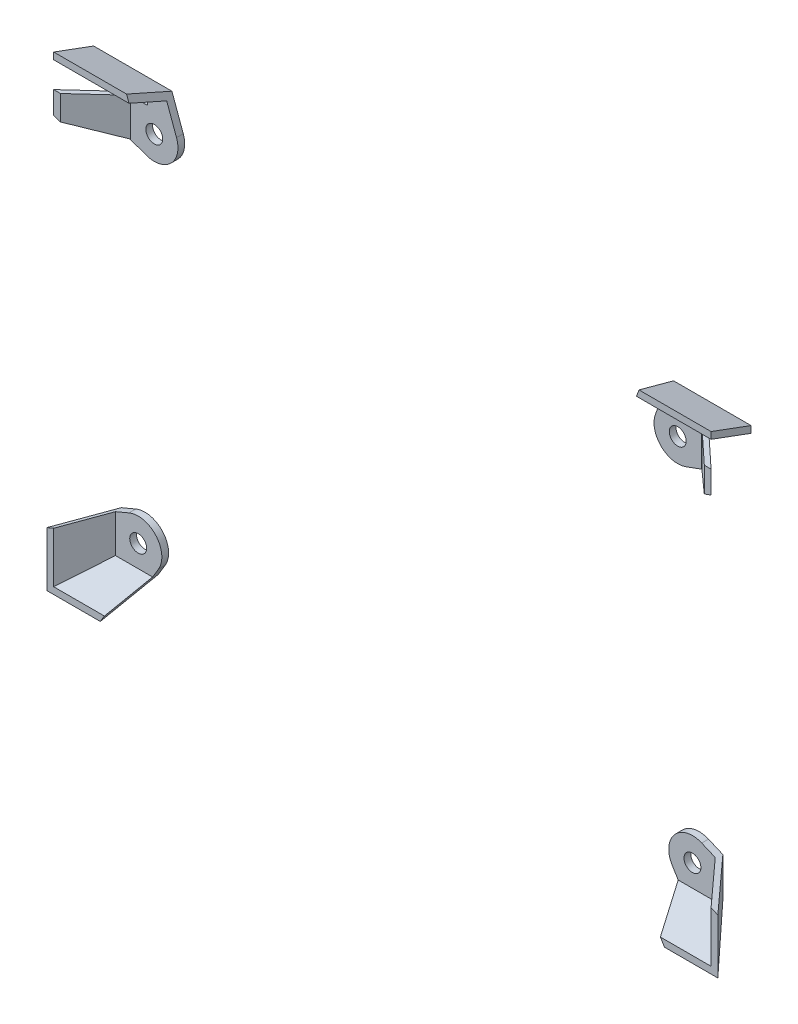
from build123d import *

# Parameters (mm, degrees)
SKETCH4_7_R              = 3.175
BOSS_EXTRUDE7_DEPTH      = 2.54
SKETCH4_9_R              = 3.175
BOSS_EXTRUDE8_DEPTH      = 2.54
BOSS_EXTRUDE9_OUTLINE_R  = 3.175
BOSS_EXTRUDE9_DEPTH      = 2.54
BOSS_EXTRUDE10_OUTLINE_R = 3.175
BOSS_EXTRUDE10_DEPTH     = 2.54


# Read off the part's stored shape, not the designer's step: Boss-Extrude9, Boss-Extrude10
with BuildPart() as part:
    # Sketch9 → Loft2 section 0
    with BuildSketch(Plane.XY):
        with BuildLine():
            Line((-113.266429258, -70.57186866), (-113.266429258, -85.367634727))
            Line((-113.266429258, -85.367634727), (-99.366399677, -85.367634727))
            Line((-99.366399677, -85.367634727), (-97.8285786, -82.827634727))
            Line((-97.8285786, -82.827634727), (-110.726429258, -82.827634727))
            Line((-110.726429258, -82.827634727), (-110.726429258, -69.503807701))
            Line((-110.726429258, -69.503807701), (-113.266429258, -70.57186866))
        make_face()
    # Sketch8 → Loft2 section 1
    with BuildSketch(Plane.XY.offset(15.022907724)):
        with BuildLine():
            Line((-104.580681896, -93.98), (-123.630681896, -93.98))
            Line((-123.630681896, -93.98), (-123.630681896, -74.93))
            Line((-123.630681896, -74.93), (-126.170681896, -75.998060958))
            Line((-126.170681896, -75.998060958), (-126.170681896, -96.52))
            Line((-126.170681896, -96.52), (-106.118502973, -96.52))
            Line((-106.118502973, -96.52), (-104.580681896, -93.98))
        make_face()
    loft()

    # Sketch4<7> → Boss-Extrude7 (add)
    with BuildSketch(Plane.XY):
        with BuildLine():
            Line((-107.82238401, -68.282667012), (-113.266429258, -70.57186866))
            Line((-113.266429258, -70.57186866), (-113.266429258, -85.367634727))
            Line((-113.266429258, -85.367634727), (-99.366399677, -85.367634727))
            Line((-99.366399677, -85.367634727), (-96.771633973, -81.081892394))
            ThreePointArc((-96.771633973, -81.081892394), (-97.647459705, -70.667895597), (-107.82238401, -68.282667012))
        make_face()
        with Locations((-104.376429258, -76.477634727)):
            Circle(SKETCH4_7_R, mode=Mode.SUBTRACT)
    extrude(amount=BOSS_EXTRUDE7_DEPTH)


with BuildPart() as body_2:
    # Sketch11 → Loft3 section 0
    with BuildSketch(Plane.XY):
        with BuildLine():
            Line((98.890490417, -85.188992609), (112.752003689, -85.188992609))
            Line((112.752003689, -85.188992609), (112.752003689, -70.421530974))
            Line((112.752003689, -70.421530974), (110.212003689, -69.340220039))
            Line((110.212003689, -69.340220039), (110.212003689, -82.648992609))
            Line((110.212003689, -82.648992609), (97.329707935, -82.648992609))
            Line((97.329707935, -82.648992609), (98.890490417, -85.188992609))
        make_face()
    # Sketch10 → Loft3 section 1
    with BuildSketch(Plane.XY.offset(15.022907724)):
        with BuildLine():
            Line((123.3424, -93.98), (123.3424, -74.93))
            Line((123.3424, -74.93), (125.8824, -76.011310934))
            Line((125.8824, -76.011310934), (125.8824, -96.52))
            Line((125.8824, -96.52), (105.853182483, -96.52))
            Line((105.853182483, -96.52), (104.2924, -93.98))
            Line((104.2924, -93.98), (123.3424, -93.98))
        make_face()
    loft()

    # Sketch4<9> → Boss-Extrude8 (add)
    with BuildSketch(Plane.XY):
        with BuildLine():
            ThreePointArc((107.344182942, -68.119351562), (97.126751505, -70.496538128), (96.287708925, -80.953255045))
            Line((96.287708925, -80.953255045), (98.890490417, -85.188992609))
            Line((98.890490417, -85.188992609), (112.752003689, -85.188992609))
            Line((112.752003689, -85.188992609), (112.752003689, -70.421530974))
            Line((112.752003689, -70.421530974), (107.344182942, -68.119351562))
        make_face()
        with Locations((103.862003689, -76.298992609)):
            Circle(SKETCH4_9_R, mode=Mode.SUBTRACT)
    extrude(amount=BOSS_EXTRUDE8_DEPTH)


with BuildPart() as body_3:
    # Sketch12 → Loft4 section 0
    with BuildSketch(Plane.XY.offset(15.022907724)):
        with BuildLine():
            Line((96.262433744, 80.01), (123.3424, 80.01))
            Line((123.3424, 80.01), (123.3424, 77.47))
            Line((123.3424, 77.47), (95.337949349, 77.47))
            Line((95.337949349, 77.47), (96.262433744, 80.01))
        make_face()
    # Sketch14 → Loft4 section 1
    with BuildSketch(Plane.XY):
        with BuildLine():
            Line((93.315797821, 71.91418434), (94.240282216, 74.45418434))
            Line((94.240282216, 74.45418434), (123.3424, 74.45418434))
            Line((123.3424, 74.45418434), (123.3424, 71.91418434))
            Line((123.3424, 71.91418434), (93.315797821, 71.91418434))
        make_face()
    loft()



with BuildPart() as body_4:
    # Sketch14<3> → Loft5 section 0
    with BuildSketch(Plane.XY):
        with BuildLine():
            Line((107.217257067, 67.78668434), (104.677257067, 67.78668434))
            Line((104.677257067, 67.78668434), (104.677257067, 52.54110493))
            Line((104.677257067, 52.54110493), (107.217257067, 53.465589325))
            Line((107.217257067, 53.465589325), (107.217257067, 67.78668434))
        make_face()
    # Sketch12<3> → Loft5 section 1
    with BuildSketch(Plane.XY.offset(15.022907724)):
        with BuildLine():
            Line((123.3424, 59.334661376), (123.3424, 67.78668434))
            Line((123.3424, 67.78668434), (120.8024, 67.78668434))
            Line((120.8024, 67.78668434), (120.8024, 58.410176981))
            Line((120.8024, 58.410176981), (123.3424, 59.334661376))
        make_face()
    loft()


with BuildPart() as body_3_1:
    add(body_3.part)

    add(body_4.part)  # Boss-Extrude9 merges body 4
    # Boss-Extrude9 outline → Boss-Extrude9 (add)
    with BuildSketch(Plane.XY):
        with BuildLine():
            ThreePointArc((89.973389669, 62.730993414), (92.041077783, 53.404255055), (101.367816142, 51.336566941))
            Line((101.367816142, 51.336566941), (107.217257067, 53.465589325))
            Line((107.217257067, 53.465589325), (107.217257067, 67.78668434))
            Line((107.217257067, 67.78668434), (100.867257067, 67.78668434))
            Line((100.867257067, 67.78668434), (100.867257067, 74.45418434))
            Line((100.867257067, 74.45418434), (94.240282216, 74.45418434))
            Line((94.240282216, 74.45418434), (89.973389669, 62.730993414))
        make_face()
        with Locations((98.327257067, 59.69043434)):
            Circle(BOSS_EXTRUDE9_OUTLINE_R, mode=Mode.SUBTRACT)
    extrude(amount=BOSS_EXTRUDE9_DEPTH)


with BuildPart() as body_4_2:
    # Sketch16 → Loft6 section 0
    with BuildSketch(Plane.XY):
        with BuildLine():
            Line((-104.677257067, 67.78668434), (-104.677257067, 52.54110493))
            Line((-104.677257067, 52.54110493), (-107.217257067, 53.465589325))
            Line((-107.217257067, 53.465589325), (-107.217257067, 67.78668434))
            Line((-107.217257067, 67.78668434), (-104.677257067, 67.78668434))
        make_face()
    # Sketch15 → Loft6 section 1
    with BuildSketch(Plane.XY.offset(15.022907724)):
        with BuildLine():
            Line((-123.630681896, 67.78668434), (-121.090681896, 67.78668434))
            Line((-121.090681896, 67.78668434), (-121.090681896, 58.51510301))
            Line((-121.090681896, 58.51510301), (-123.630681896, 59.439587405))
            Line((-123.630681896, 59.439587405), (-123.630681896, 67.78668434))
        make_face()
    loft()



with BuildPart() as body_5:
    # Sketch15<3> → Loft7 section 0
    with BuildSketch(Plane.XY.offset(15.022907724)):
        with BuildLine():
            Line((-123.630681896, 80.01), (-96.262433744, 80.01))
            Line((-96.262433744, 80.01), (-95.337949349, 77.47))
            Line((-95.337949349, 77.47), (-123.630681896, 77.47))
            Line((-123.630681896, 77.47), (-123.630681896, 80.01))
        make_face()
    # Sketch16<3> → Loft7 section 1
    with BuildSketch(Plane.XY):
        with BuildLine():
            Line((-93.315797821, 71.91418434), (-94.240282216, 74.45418434))
            Line((-94.240282216, 74.45418434), (-123.630681896, 74.45418434))
            Line((-123.630681896, 74.45418434), (-123.630681896, 71.91418434))
            Line((-123.630681896, 71.91418434), (-93.315797821, 71.91418434))
        make_face()
    loft()


with BuildPart() as body_4_2_1:
    add(body_4_2.part)

    add(body_5.part)  # Boss-Extrude10 merges body 5
    # Boss-Extrude10 outline → Boss-Extrude10 (add)
    with BuildSketch(Plane.XY):
        with BuildLine():
            Line((-107.217257067, 53.465589325), (-101.367816142, 51.336566941))
            ThreePointArc((-101.367816142, 51.336566941), (-92.041077783, 53.404255055), (-89.973389669, 62.730993414))
            Line((-89.973389669, 62.730993414), (-94.240282216, 74.45418434))
            Line((-94.240282216, 74.45418434), (-100.867257067, 74.45418434))
            Line((-100.867257067, 74.45418434), (-100.867257067, 67.78668434))
            Line((-100.867257067, 67.78668434), (-107.217257067, 67.78668434))
            Line((-107.217257067, 67.78668434), (-107.217257067, 53.465589325))
        make_face()
        with Locations((-98.327257067, 59.69043434)):
            Circle(BOSS_EXTRUDE10_OUTLINE_R, mode=Mode.SUBTRACT)
    extrude(amount=BOSS_EXTRUDE10_DEPTH)


solid = Compound([part.part, body_2.part, body_3_1.part, body_4_2_1.part])
